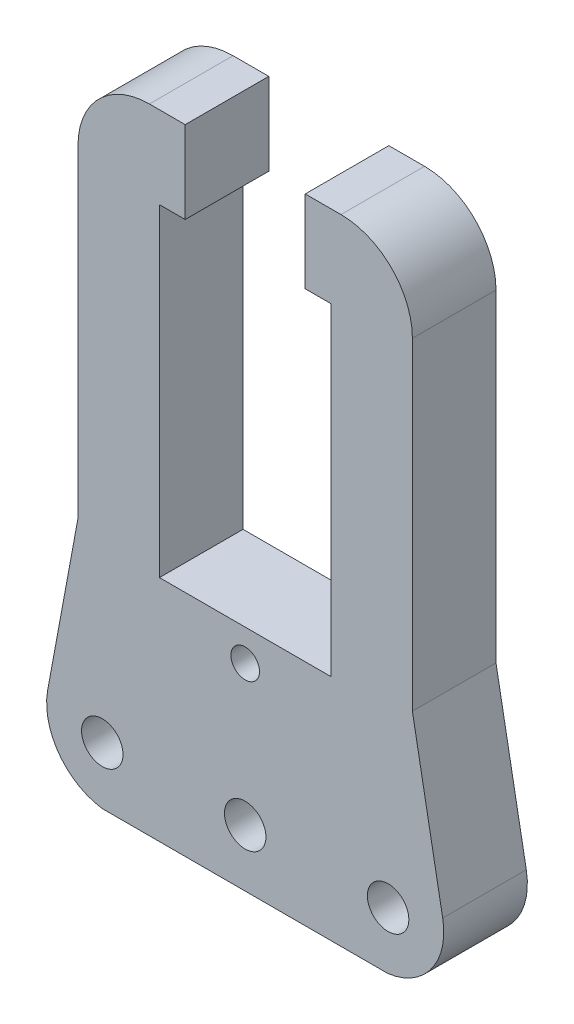
from build123d import *

# Parameters (mm, degrees)
MODEL_R             = 1.45
MODEL_R_2           = 1
BOSS_EXTRUDE1_DEPTH = 5.85


with BuildPart() as part:
    # Model → Boss-Extrude1 (new body)
    with BuildSketch(Plane.XY):
        with BuildLine():
            Line((508.282236888, 554.934833401), (506.162292927, 543.461595882))
            ThreePointArc((506.162292927, 543.461595882), (506.942268074, 540.005189461), (509.982236888, 538.184833401))
            Line((509.982236888, 538.184833401), (529.982236888, 538.184833401))
            ThreePointArc((529.982236888, 538.184833401), (533.022205702, 540.005189461), (533.80218085, 543.461595882))
            Line((533.80218085, 543.461595882), (531.682236888, 554.934833401))
            Line((531.682236888, 554.934833401), (531.682236888, 577.534833401))
            ThreePointArc((531.682236888, 577.534833401), (530.217770794, 581.070367307), (526.682236888, 582.534833401))
            Line((526.682236888, 582.534833401), (524.182236888, 582.534833401))
            Line((524.182236888, 582.534833401), (524.182236888, 576.784833401))
            Line((524.182236888, 576.784833401), (525.982236888, 576.784833401))
            Line((525.982236888, 576.784833401), (525.982236888, 554.184833401))
            Line((525.982236888, 554.184833401), (513.982236888, 554.184833401))
            Line((513.982236888, 554.184833401), (513.982236888, 576.784833401))
            Line((513.982236888, 576.784833401), (515.782236888, 576.784833401))
            Line((515.782236888, 576.784833401), (515.782236888, 582.534833401))
            Line((515.782236888, 582.534833401), (513.282236888, 582.534833401))
            ThreePointArc((513.282236888, 582.534833401), (509.746702982, 581.070367307), (508.282236888, 577.534833401))
            Line((508.282236888, 577.534833401), (508.282236888, 554.934833401))
        make_face()
        with Locations((509.982236888, 542.184833401)):
            Circle(MODEL_R, mode=Mode.SUBTRACT)
        with Locations((519.982236888, 542.184833401)):
            Circle(MODEL_R, mode=Mode.SUBTRACT)
        with Locations((529.982236888, 542.184833401)):
            Circle(MODEL_R, mode=Mode.SUBTRACT)
        with Locations((519.982236888, 551.984833401)):
            Circle(MODEL_R_2, mode=Mode.SUBTRACT)
    extrude(amount=BOSS_EXTRUDE1_DEPTH)


solid = part.part
